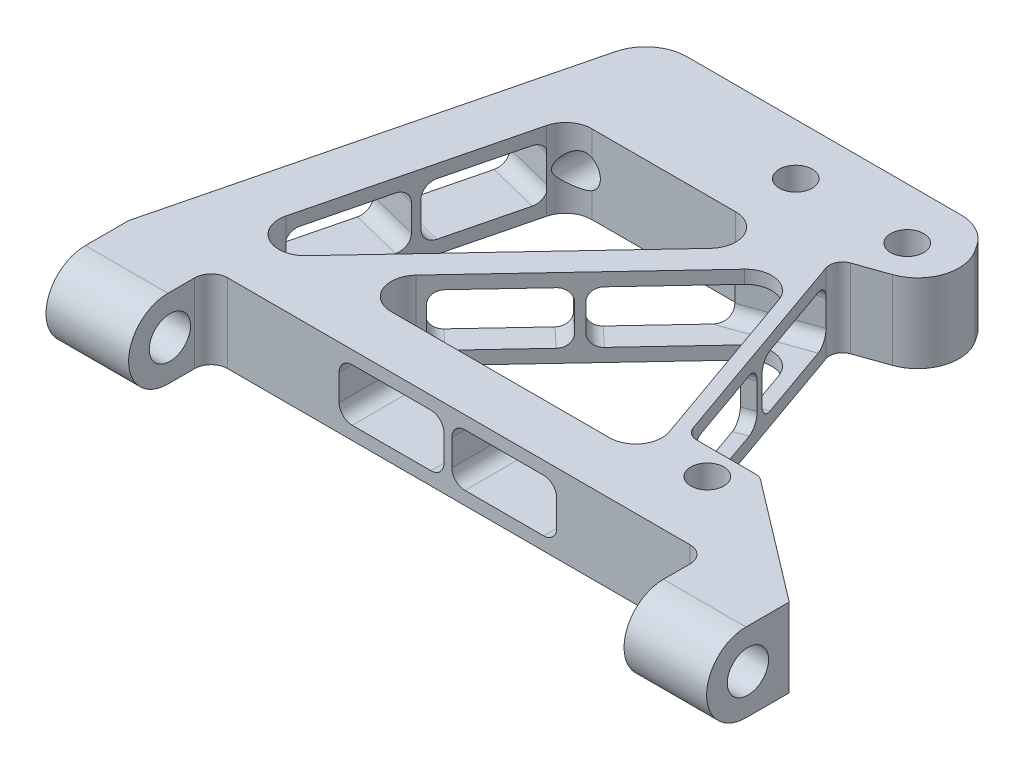
from build123d import *

# Parameters (mm, degrees)
BOSS_EXTRUDE1_DEPTH = 19.05
SKETCH7_R           = 3.96875
CUT_EXTRUDE7_DEPTH  = 38.1
SKETCH31_R          = 4
CUT_EXTRUDE18_DEPTH = 203.106166408
FILLET6_RADIUS      = 9.525
FILLET6_LENGTH      = 20
FILLET7_RADIUS      = 9.525
FILLET7_LENGTH      = 20
SKETCH27_R          = 5
CUT_EXTRUDE16_DEPTH = 203.106166408
SKETCH30_R          = 4
CUT_EXTRUDE17_DEPTH = 203.106166408
CUT_EXTRUDE19_DEPTH = 203.106166408
CUT_EXTRUDE20_DEPTH = 44
FILLET8_R           = 10
CUT_EXTRUDE21_REACH = 170.65
CUT_EXTRUDE22_REACH = 118.063
CUT_EXTRUDE23_REACH = 186.221
CUT_EXTRUDE24_REACH = 173.992


with BuildPart() as part:
    # Sketch1 → Boss-Extrude1 (new body)
    with BuildSketch(Plane(origin=(0, 0, 0), x_dir=(1, 0, 0), z_dir=(0, 1, 0))):
        with BuildLine():
            Line((0, -122), (20, -122))
            Line((20, -122), (20, -106))
            ThreePointArc((20, -106), (21.171572875, -103.171572875), (24, -102))
            Line((24, -102), (136, -102))
            ThreePointArc((136, -102), (138.828427125, -103.171572875), (140, -106))
            Line((140, -106), (140, -122))
            Line((140, -122), (160, -122))
            Line((160, -122), (160, -84))
            Line((160, -84), (105, 0))
            Line((105, 0), (25.4, 0))
            Line((25.4, 0), (0, -102))
            Line((0, -102), (0, -122))
        make_face()
    extrude(amount=BOSS_EXTRUDE1_DEPTH)

    # Sketch7 → Cut-Extrude7 (cut)
    with BuildSketch(Plane(origin=(0, 0, 0), x_dir=(-1, 0, 0), z_dir=(0, 0, -1))):
        with Locations((-34.925, 9.525)):
            Circle(SKETCH7_R)
    extrude(amount=-CUT_EXTRUDE7_DEPTH, mode=Mode.SUBTRACT)

    # Sketch31 → Cut-Extrude18 (cut, through all)
    with BuildSketch(Plane(origin=(0, 19.05, 0), x_dir=(1, 0, 0), z_dir=(0, 1, 0))):
        with Locations(Location((123.750569229, -85.577337428, 0), (0, 0, 270))):
            Circle(SKETCH31_R)
    extrude(amount=-CUT_EXTRUDE18_DEPTH, mode=Mode.SUBTRACT)

    # Fillet6: full round fillet: the end face becomes a half cylinder, R = half its width
    fillet6_face = Plane((10, 9.525, 122), x_dir=(1, 0, 0), z_dir=(0, 0, 1))  # on the end face: x along it, z out of the body
    fillet6_slab = fillet6_face.offset(-FILLET6_RADIUS / 2) * Box(FILLET6_LENGTH, 2 * FILLET6_RADIUS, FILLET6_RADIUS, mode=Mode.PRIVATE)  # the body's end, R deep
    fillet6_round = Plane((10, 9.525, 112.475), x_dir=(0, 0, 1), z_dir=(1, 0, 0)) * Cylinder(FILLET6_RADIUS, FILLET6_LENGTH, mode=Mode.PRIVATE)  # its axis R under the face
    add(fillet6_slab - fillet6_round, mode=Mode.SUBTRACT)

    # Fillet7: full round fillet: the end face becomes a half cylinder, R = half its width
    fillet7_face = Plane((150, 9.525, 122), x_dir=(1, 0, 0), z_dir=(0, 0, 1))  # on the end face: x along it, z out of the body
    fillet7_slab = fillet7_face.offset(-FILLET7_RADIUS / 2) * Box(FILLET7_LENGTH, 2 * FILLET7_RADIUS, FILLET7_RADIUS, mode=Mode.PRIVATE)  # the body's end, R deep
    fillet7_round = Plane((150, 9.525, 112.475), x_dir=(0, 0, 1), z_dir=(1, 0, 0)) * Cylinder(FILLET7_RADIUS, FILLET7_LENGTH, mode=Mode.PRIVATE)  # its axis R under the face
    add(fillet7_slab - fillet7_round, mode=Mode.SUBTRACT)

    # Sketch27 → Cut-Extrude16 (cut, through all)
    with BuildSketch(Plane.ZY):
        with Locations((112, 9.525)):
            Circle(SKETCH27_R)
    extrude(amount=-CUT_EXTRUDE16_DEPTH, mode=Mode.SUBTRACT)

    # Sketch30 → Cut-Extrude17 (cut, through all)
    with BuildSketch(Plane.XZ):
        with Locations(Location((72, 12.414156832, 0), (0, 0, 270))):
            Circle(SKETCH30_R)
        with Locations(Location((99, 12.414156832, 0), (0, 0, 270))):
            Circle(SKETCH30_R)
    extrude(amount=-CUT_EXTRUDE17_DEPTH, mode=Mode.SUBTRACT)

    # Sketch32 → Cut-Extrude19 (cut, through all)
    with BuildSketch(Plane(origin=(0, 19.05, 0), x_dir=(1, 0, 0), z_dir=(0, 1, 0))):
        with BuildLine():
            ThreePointArc((71.677934079, -26.634288881), (77.505742976, -30.462554664), (76.306653797, -37.331409051))
            Line((76.306653797, -37.331409051), (28.868492384, -87.842539296))
            ThreePointArc((28.868492384, -87.842539296), (21.20074064, -89.070971505), (18.077949002, -81.961004213))
            Line((18.077949002, -81.961004213), (30.656210847, -31.449873968))
            ThreePointArc((30.656210847, -31.449873968), (32.907857706, -27.980988236), (36.818034512, -26.634288881))
            Line((36.818034512, -26.634288881), (71.677934079, -26.634288881))
        make_face()
        with BuildLine():
            Line((109.779898668, -80.842599107), (95.362721275, -39.863015693))
            ThreePointArc((95.362721275, -39.863015693), (90.683122858, -35.757118611), (84.74389626, -37.623296415))
            Line((84.74389626, -37.623296415), (46.257406585, -78.60287983))
            ThreePointArc((46.257406585, -78.60287983), (45.058317405, -85.471734217), (50.886126302, -89.3))
            Line((50.886126302, -89.3), (103.789793371, -89.3))
            ThreePointArc((103.789793371, -89.3), (108.971708831, -86.620184214), (109.779898668, -80.842599107))
        make_face()
    extrude(amount=-CUT_EXTRUDE19_DEPTH, mode=Mode.SUBTRACT)

    # Sketch33 → Cut-Extrude20 (cut)
    with BuildSketch(Plane(origin=(0, 19.05, 0), x_dir=(1, 0, 0), z_dir=(0, 1, 0))):
        with BuildLine():
            Line((160, -102), (130.95291769, -79.876521823))
            ThreePointArc((130.95291769, -79.876521823), (130.044325388, -79.394008195), (129.029150414, -79.227337428))
            Line((129.029150414, -79.227337428), (114.838776508, -79.227337428))
            ThreePointArc((114.838776508, -79.227337428), (113.003684401, -78.643295158), (111.843723859, -77.106037874))
            Line((111.843723859, -77.106037874), (94.391164688, -27.498643525))
            ThreePointArc((94.391164688, -27.498643525), (94.523316568, -25.072199772), (96.33251689, -23.44989043))
            Line((96.33251689, -23.44989043), (115.85663306, -16.581039583))
            Line((115.85663306, -16.581039583), (160, -84))
            Line((160, -84), (160, -102))
        make_face()
    extrude(amount=-CUT_EXTRUDE20_DEPTH, mode=Mode.SUBTRACT)

    # Fillet8
    # the kernel refuses this fillet: 10 mm, written as the material it takes off along each edge
    with BuildSketch(Plane(origin=(115.85663306, 50.952416451, 16.581039583), x_dir=(-0.5477859413637759, 0, -0.836618528628312), z_dir=(0, -1, 0))) as fillet8_piece_1:
        with BuildLine():
            CenterArc((FILLET8_R * 1.27609665805, -FILLET8_R), FILLET8_R, 90, 103.832682803)
            Line((FILLET8_R * 0.305098600984, -FILLET8_R * 1.2390873756), (0, 0))
            Line((0, 0), (FILLET8_R * 1.27609665805, 0))
        make_face()
    extrude(amount=82.854832903, mode=Mode.SUBTRACT)
    with BuildSketch(Plane(origin=(25.4, -19.537986436, 0), x_dir=(1, 0, 0), z_dir=(0, 1, 0))) as fillet8_piece_2:
        with BuildLine():
            CenterArc((FILLET8_R * 0.781519457448, -FILLET8_R), FILLET8_R, 90, 76.016636793)
            Line((-FILLET8_R * 0.188846474015, -FILLET8_R * 0.758359856283), (0, 0))
            Line((0, 0), (FILLET8_R * 0.781519457448, 0))
        make_face()
    extrude(amount=58.125972872, mode=Mode.SUBTRACT)
    with BuildSketch(Plane(origin=(105, -13.513149756, 0), x_dir=(-1, 0, 0), z_dir=(0, 1, 0))) as fillet8_piece_3:
        with BuildLine():
            CenterArc((FILLET8_R * 0.540525990236, FILLET8_R), FILLET8_R, 213.215251494, 56.784748506)
            Line((-FILLET8_R * 0.296092538393, FILLET8_R * 0.452214058636), (0, 0))
            Line((0, 0), (FILLET8_R * 0.540525990236, 0))
        make_face()
    extrude(amount=46.076299512, mode=Mode.SUBTRACT)

    # Sketch34 → Cut-Extrude21 (cut, up to next)
    with BuildSketch(Plane(origin=(36.24054237, 0, 9.024605649), x_dir=(0.24164014371728681, 0, -0.9703659314631202), z_dir=(0.9703659314631203, 0, 0.24164014371728684)), mode=Mode.PRIVATE) as cut_extrude21_sk1:
        with BuildLine():
            Line((-45.009461527, 3.175), (-25.959461527, 3.175))
            ThreePointArc((-25.959461527, 3.175), (-23.714397497, 4.10493597), (-22.784461527, 6.35))
            Line((-22.784461527, 6.35), (-22.784461527, 12.7))
            ThreePointArc((-22.784461527, 12.7), (-23.714397497, 14.94506403), (-25.959461527, 15.875))
            Line((-25.959461527, 15.875), (-45.009461527, 15.875))
            ThreePointArc((-45.009461527, 15.875), (-47.254525557, 14.94506403), (-48.184461527, 12.7))
            Line((-48.184461527, 12.7), (-48.184461527, 6.35))
            ThreePointArc((-48.184461527, 6.35), (-47.254525557, 4.10493597), (-45.009461527, 3.175))
        make_face()
    cut_extrude21_tool1 = extrude(cut_extrude21_sk1.sketch, amount=-CUT_EXTRUDE21_REACH, mode=Mode.PRIVATE) & part.part
    # Sketch34 → Cut-Extrude21 (cut, up to next)
    with BuildSketch(Plane(origin=(36.24054237, 0, 9.024605649), x_dir=(0.24164014371728681, 0, -0.9703659314631202), z_dir=(0.9703659314631203, 0, 0.24164014371728684)), mode=Mode.PRIVATE) as cut_extrude21_sk2:
        with BuildLine():
            Line((-50.089461527, 12.7), (-50.089461527, 6.35))
            ThreePointArc((-50.089461527, 6.35), (-51.019397497, 4.10493597), (-53.264461527, 3.175))
            Line((-53.264461527, 3.175), (-72.314461527, 3.175))
            ThreePointArc((-72.314461527, 3.175), (-74.559525557, 4.10493597), (-75.489461527, 6.35))
            Line((-75.489461527, 6.35), (-75.489461527, 12.7))
            ThreePointArc((-75.489461527, 12.7), (-74.559525557, 14.94506403), (-72.314461527, 15.875))
            Line((-72.314461527, 15.875), (-53.264461527, 15.875))
            ThreePointArc((-53.264461527, 15.875), (-51.019397497, 14.94506403), (-50.089461527, 12.7))
        make_face()
    cut_extrude21_tool2 = extrude(cut_extrude21_sk2.sketch, amount=-CUT_EXTRUDE21_REACH, mode=Mode.PRIVATE) & part.part
    add(cut_extrude21_tool1.solids().sort_by_distance((27.666072, 9.525, 43.457518))[0], mode=Mode.SUBTRACT)
    add(cut_extrude21_tool2.solids().sort_by_distance((21.068088, 9.525, 69.95336))[0], mode=Mode.SUBTRACT)

    # Sketch35 → Cut-Extrude22 (cut, up to next)
    with BuildSketch(Plane(origin=(63.80266223, 0, 59.921070361), x_dir=(0.684585853576135, 0, -0.7289322390204968), z_dir=(0.7289322390204968, 0, 0.684585853576135)), mode=Mode.PRIVATE) as cut_extrude22_sk1:
        with BuildLine():
            Line((6.607815922, 3.175), (25.657815922, 3.175))
            ThreePointArc((25.657815922, 3.175), (27.902879952, 4.10493597), (28.832815922, 6.35))
            Line((28.832815922, 6.35), (28.832815922, 12.7))
            ThreePointArc((28.832815922, 12.7), (27.902879952, 14.94506403), (25.657815922, 15.875))
            Line((25.657815922, 15.875), (6.607815922, 15.875))
            ThreePointArc((6.607815922, 15.875), (4.362751892, 14.94506403), (3.432815922, 12.7))
            Line((3.432815922, 12.7), (3.432815922, 6.35))
            ThreePointArc((3.432815922, 6.35), (4.362751892, 4.10493597), (6.607815922, 3.175))
        make_face()
    cut_extrude22_tool1 = extrude(cut_extrude22_sk1.sketch, amount=-CUT_EXTRUDE22_REACH, mode=Mode.PRIVATE) & part.part
    # Sketch35 → Cut-Extrude22 (cut, up to next)
    with BuildSketch(Plane(origin=(63.80266223, 0, 59.921070361), x_dir=(0.684585853576135, 0, -0.7289322390204968), z_dir=(0.7289322390204968, 0, 0.684585853576135)), mode=Mode.PRIVATE) as cut_extrude22_sk2:
        with BuildLine():
            Line((1.527815922, 12.7), (1.527815922, 6.35))
            ThreePointArc((1.527815922, 6.35), (0.597879952, 4.10493597), (-1.647184078, 3.175))
            Line((-1.647184078, 3.175), (-20.697184078, 3.175))
            ThreePointArc((-20.697184078, 3.175), (-22.942248108, 4.10493597), (-23.872184078, 6.35))
            Line((-23.872184078, 6.35), (-23.872184078, 12.7))
            ThreePointArc((-23.872184078, 12.7), (-22.942248108, 14.94506403), (-20.697184078, 15.875))
            Line((-20.697184078, 15.875), (-1.647184078, 15.875))
            ThreePointArc((-1.647184078, 15.875), (0.597879952, 14.94506403), (1.527815922, 12.7))
        make_face()
    cut_extrude22_tool2 = extrude(cut_extrude22_sk2.sketch, amount=-CUT_EXTRUDE22_REACH, mode=Mode.PRIVATE) & part.part
    add(cut_extrude22_tool1.solids().sort_by_distance((74.84696, 9.525, 48.161341))[0], mode=Mode.SUBTRACT)
    add(cut_extrude22_tool2.solids().sort_by_distance((56.154343, 9.525, 68.064836))[0], mode=Mode.SUBTRACT)

    # Sketch36 → Cut-Extrude23 (cut, up to next)
    with BuildSketch(Plane(origin=(0, 0, 89.3), x_dir=(-1, 0, 0), z_dir=(0, 0, -1)), mode=Mode.PRIVATE) as cut_extrude23_sk1:
        with BuildLine():
            Line((-73.210459837, 3.202282531), (-54.160459837, 3.202282531))
            ThreePointArc((-54.160459837, 3.202282531), (-51.915395806, 4.132218501), (-50.985459837, 6.377282531))
            Line((-50.985459837, 6.377282531), (-50.985459837, 12.727282531))
            ThreePointArc((-50.985459837, 12.727282531), (-51.915395806, 14.972346562), (-54.160459837, 15.902282531))
            Line((-54.160459837, 15.902282531), (-73.210459837, 15.902282531))
            ThreePointArc((-73.210459837, 15.902282531), (-75.455523867, 14.972346562), (-76.385459837, 12.727282531))
            Line((-76.385459837, 12.727282531), (-76.385459837, 6.377282531))
            ThreePointArc((-76.385459837, 6.377282531), (-75.455523867, 4.132218501), (-73.210459837, 3.202282531))
        make_face()
    cut_extrude23_tool1 = extrude(cut_extrude23_sk1.sketch, amount=-CUT_EXTRUDE23_REACH, mode=Mode.PRIVATE) & part.part
    # Sketch36 → Cut-Extrude23 (cut, up to next)
    with BuildSketch(Plane(origin=(0, 0, 89.3), x_dir=(-1, 0, 0), z_dir=(0, 0, -1)), mode=Mode.PRIVATE) as cut_extrude23_sk2:
        with BuildLine():
            Line((-78.290459837, 12.727282531), (-78.290459837, 6.377282531))
            ThreePointArc((-78.290459837, 6.377282531), (-79.220395806, 4.132218501), (-81.465459837, 3.202282531))
            Line((-81.465459837, 3.202282531), (-100.515459837, 3.202282531))
            ThreePointArc((-100.515459837, 3.202282531), (-102.760523867, 4.132218501), (-103.690459837, 6.377282531))
            Line((-103.690459837, 6.377282531), (-103.690459837, 12.727282531))
            ThreePointArc((-103.690459837, 12.727282531), (-102.760523867, 14.972346562), (-100.515459837, 15.902282531))
            Line((-100.515459837, 15.902282531), (-81.465459837, 15.902282531))
            ThreePointArc((-81.465459837, 15.902282531), (-79.220395806, 14.972346562), (-78.290459837, 12.727282531))
        make_face()
    cut_extrude23_tool2 = extrude(cut_extrude23_sk2.sketch, amount=-CUT_EXTRUDE23_REACH, mode=Mode.PRIVATE) & part.part
    add(cut_extrude23_tool1.solids().sort_by_distance((63.68546, 9.552283, 89.3))[0], mode=Mode.SUBTRACT)
    add(cut_extrude23_tool2.solids().sort_by_distance((90.99046, 9.552283, 89.3))[0], mode=Mode.SUBTRACT)

    # Sketch37 → Cut-Extrude24 (cut, up to next)
    with BuildSketch(Plane(origin=(75.386022926, 0, -26.521832945), x_dir=(-0.3318741563662695, 0, -0.9433236689154879), z_dir=(0.9433236689154878, 0, -0.33187415636626943)), mode=Mode.PRIVATE) as cut_extrude24_sk1:
        with BuildLine():
            Line((-79.432550747, 3.175), (-60.382550747, 3.175))
            ThreePointArc((-60.382550747, 3.175), (-58.137486716, 4.10493597), (-57.207550747, 6.35))
            Line((-57.207550747, 6.35), (-57.207550747, 12.7))
            ThreePointArc((-57.207550747, 12.7), (-58.137486716, 14.94506403), (-60.382550747, 15.875))
            Line((-60.382550747, 15.875), (-79.432550747, 15.875))
            ThreePointArc((-79.432550747, 15.875), (-81.677614777, 14.94506403), (-82.607550747, 12.7))
            Line((-82.607550747, 12.7), (-82.607550747, 6.35))
            ThreePointArc((-82.607550747, 6.35), (-81.677614777, 4.10493597), (-79.432550747, 3.175))
        make_face()
    cut_extrude24_tool1 = extrude(cut_extrude24_sk1.sketch, amount=-CUT_EXTRUDE24_REACH, mode=Mode.PRIVATE) & part.part
    # Sketch37 → Cut-Extrude24 (cut, up to next)
    with BuildSketch(Plane(origin=(75.386022926, 0, -26.521832945), x_dir=(-0.3318741563662695, 0, -0.9433236689154879), z_dir=(0.9433236689154878, 0, -0.33187415636626943)), mode=Mode.PRIVATE) as cut_extrude24_sk2:
        with BuildLine():
            Line((-84.512550747, 12.7), (-84.512550747, 6.35))
            ThreePointArc((-84.512550747, 6.35), (-85.442486716, 4.10493597), (-87.687550747, 3.175))
            Line((-87.687550747, 3.175), (-106.737550747, 3.175))
            ThreePointArc((-106.737550747, 3.175), (-108.982614777, 4.10493597), (-109.912550747, 6.35))
            Line((-109.912550747, 6.35), (-109.912550747, 12.7))
            ThreePointArc((-109.912550747, 12.7), (-108.982614777, 14.94506403), (-106.737550747, 15.875))
            Line((-106.737550747, 15.875), (-87.687550747, 15.875))
            ThreePointArc((-87.687550747, 15.875), (-85.442486716, 14.94506403), (-84.512550747, 12.7))
        make_face()
    cut_extrude24_tool2 = extrude(cut_extrude24_sk2.sketch, amount=-CUT_EXTRUDE24_REACH, mode=Mode.PRIVATE) & part.part
    add(cut_extrude24_tool1.solids().sort_by_distance((98.586532, 9.525, 39.423614))[0], mode=Mode.SUBTRACT)
    add(cut_extrude24_tool2.solids().sort_by_distance((107.648356, 9.525, 65.181067))[0], mode=Mode.SUBTRACT)


solid = part.part
